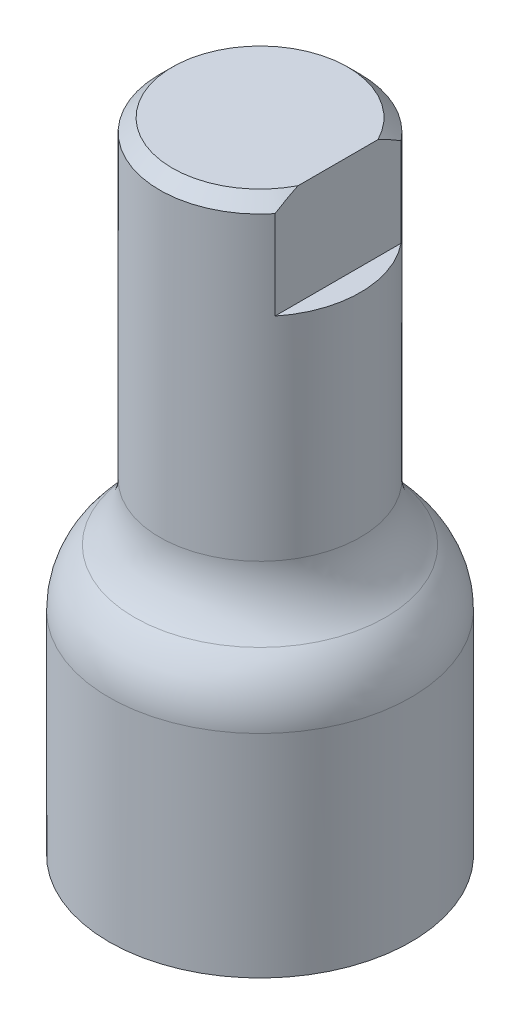
from build123d import *

# Parameters (mm, degrees)
SKETCH1_R           = 6.2865
BASE_EXTRUDE_DEPTH  = 40
SKETCH3_R           = 9.4615
BOSS_EXTRUDE1_DEPTH = 15.875
SKETCH4_R           = 6.35
CUT_EXTRUDE1_DEPTH  = 12.7
FILLET1_R           = 4.7625
FILLET2_R           = 4.7625
CUT_EXTRUDE3_START  = -6.35
CUT_EXTRUDE3_DEPTH  = 6.35
CHAMFER1_SIZE       = 0.79375


with BuildPart() as part:
    # Sketch1 → Base-Extrude (new body)
    with BuildSketch(Plane(origin=(0, 0, 0), x_dir=(-1, 0, 0), z_dir=(0, 1, 0))):
        with Locations(Location((0, 0, 0), (0, 0, 90))):
            Circle(SKETCH1_R)
    extrude(amount=BASE_EXTRUDE_DEPTH)

    # Sketch3 → Boss-Extrude1 (add)
    with BuildSketch(Plane(origin=(0, 0, 0), x_dir=(-1, 0, 0), z_dir=(0, 1, 0))):
        with Locations(Location((0, 0, 0), (0, 0, 90))):
            Circle(SKETCH3_R)
    extrude(amount=BOSS_EXTRUDE1_DEPTH)

    # Sketch4 → Cut-Extrude1 (cut)
    with BuildSketch(Plane(origin=(0, 0, 0), x_dir=(-1, 0, 0), z_dir=(0, 1, 0))):
        with Locations(Location((0, 0, 0), (0, 0, 90))):
            Circle(SKETCH4_R)
    extrude(amount=CUT_EXTRUDE1_DEPTH, mode=Mode.SUBTRACT)

    # Fillet1
    # the kernel refuses this fillet: 4.7625 mm, written as the material it adds along each edge
    with BuildSketch(Plane(origin=(0, 15.875, 0), x_dir=(0, 0, 1), z_dir=(1, 0, 0))) as fillet1_piece_1:
        with BuildLine():
            CenterArc((11.049, -4.490128061), FILLET1_R, 109.471220634, 70.528779366)
            Line((6.2865, -4.490128061), (6.19125, -4.490128061))
            Line((6.19125, -4.490128061), (6.19125, 0))
            Line((6.19125, 0), (6.2865, 0.09525))
            ThreePointArc((6.2865, 0.09525), (7.874, 0.09525), (9.42975, 0.089802561))
            Line((9.42975, 0.089802561), (9.4615, 0))
        make_face()
    revolve(axis=Axis((0, 15.875, 0), (0, -1, 0)))

    # Fillet2
    fillet2_edges = [part.edges().sort_by_distance(p)[0] for p in [
        (0, 15.875, -9.4615),
    ]]
    fillet(fillet2_edges, radius=FILLET2_R)

    # Sketch7 → Cut-Extrude3 (cut)
    with BuildSketch(Plane(origin=(0, 40, 0), x_dir=(-1, 0, 0), z_dir=(0, 1, 0)).offset(CUT_EXTRUDE3_START)):
        with BuildLine():
            Line((-4.8895, 3.951312693), (-4.8895, -3.951312693))
            ThreePointArc((-4.8895, -3.951312693), (-6.2865, 0), (-4.8895, 3.951312693))
        make_face()
    extrude(amount=CUT_EXTRUDE3_DEPTH, mode=Mode.SUBTRACT)

    # Chamfer1
    chamfer1_edges = [part.edges().sort_by_distance(p)[0] for p in [
        (-5.67274226, 40, -2.70925774),
    ]]
    chamfer(chamfer1_edges, length=CHAMFER1_SIZE)


solid = part.part
